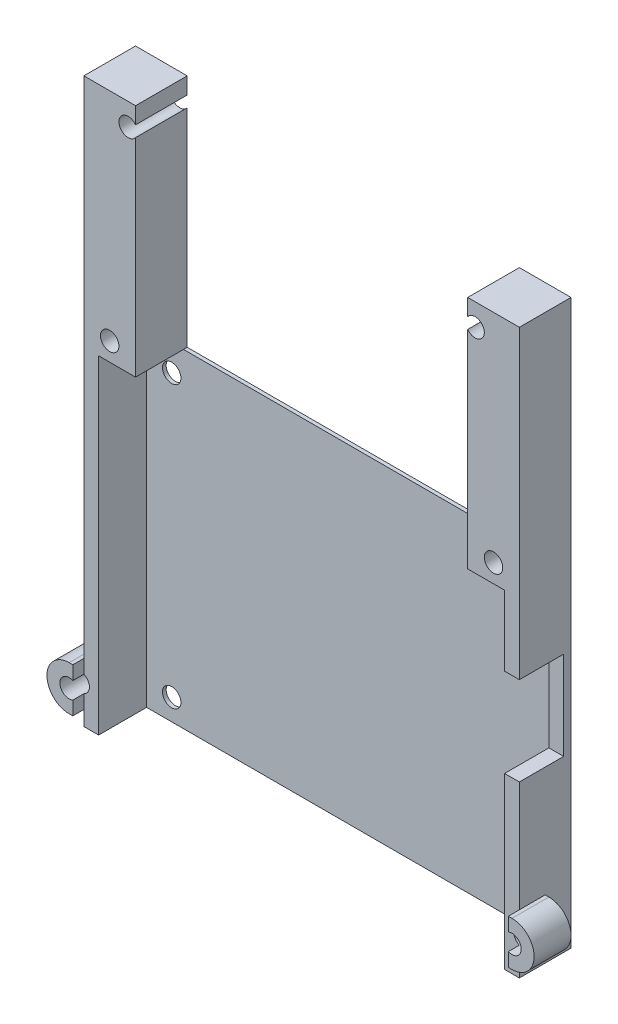
from build123d import *
from build123d.topology import SkipClean

# Parameters (mm, degrees)
BOSS_EXTRUDE1_DEPTH = 44.5
SKETCH2_W           = 6
SKETCH2_H           = 12
CUT_EXTRUDE1_DEPTH  = 10
BOSS_EXTRUDE2_DEPTH = 8.5
CUT_EXTRUDE2_DEPTH  = 11
SKETCH4_W           = 7
SKETCH4_H           = 7
BOSS_EXTRUDE3_DEPTH = 5
SKETCH9_W           = 7
SKETCH9_H           = 7
BOSS_EXTRUDE5_DEPTH = 26.85
SKETCH5_R           = 1.25
CUT_EXTRUDE3_DEPTH  = 100.034451076
SKETCH7_R           = 1.25
CUT_EXTRUDE4_DEPTH  = 10
CUT_EXTRUDE6_DEPTH  = 3.5
BOSS_EXTRUDE4_DEPTH = 3


with BuildPart() as part:
    # Sketch1 → Boss-Extrude1 (new body)
    with BuildSketch(Plane(origin=(0, 0, 0), x_dir=(1, 0, 0), z_dir=(0, 1, 0))):
        Polygon((0, 0), (2, 0), (2, 6.5), (57, 6.5), (57, 0), (59, 0), (59, 7), (0, 7), align=None)
    extrude(amount=BOSS_EXTRUDE1_DEPTH)

    # Sketch2 → Cut-Extrude1 (cut)
    with BuildSketch(Plane(origin=(59, 0, 0), x_dir=(0, 0, -1), z_dir=(1, 0, 0))):
        with Locations((3, 29)):
            Rectangle(SKETCH2_W, SKETCH2_H)
    extrude(amount=-CUT_EXTRUDE1_DEPTH, mode=Mode.SUBTRACT)

    # Sketch3 → Boss-Extrude2 (add)
    with BuildSketch(Plane(origin=(0, 0, -7), x_dir=(-1, 0, 0), z_dir=(0, 0, -1))):
        with BuildLine():
            Line((-59, 6.145643924), (-59, 8))
            Line((-59, 8), (-59.5, 8))
            ThreePointArc((-59.5, 8), (-62.5, 5), (-59.5, 2))
            Line((-59.5, 2), (-59, 2))
            Line((-59, 2), (-59, 3.854356076))
            ThreePointArc((-59, 3.854356076), (-60.75, 5), (-59, 6.145643924))
        make_face()
        with BuildLine():
            Line((0.5, 8), (0, 8))
            Line((0, 8), (0, 6.145643924))
            ThreePointArc((0, 6.145643924), (1.75, 5), (0, 3.854356076))
            Line((0, 3.854356076), (0, 2))
            Line((0, 2), (0.5, 2))
            ThreePointArc((0.5, 2), (3.5, 5), (0.5, 8))
        make_face()
    extrude(amount=-BOSS_EXTRUDE2_DEPTH)

    # Sketch3<3> → Cut-Extrude2 (cut)
    with SkipClean():  # the faces are left unmerged after this step: merging them gives an invalid solid
        with BuildSketch(Plane(origin=(0, 0, -7), x_dir=(-1, 0, 0), z_dir=(0, 0, -1))):
            with BuildLine():
                ThreePointArc((-59, 3.854356076), (-58.25, 5), (-59, 6.145643924))
                Line((-59, 6.145643924), (-59, 3.854356076))
            make_face()
            with BuildLine():
                Line((0, 3.854356076), (0, 6.145643924))
                ThreePointArc((0, 6.145643924), (-0.75, 5), (0, 3.854356076))
            make_face()
        extrude(amount=-CUT_EXTRUDE2_DEPTH, mode=Mode.SUBTRACT)

    # Sketch4 → Boss-Extrude3 (add)
    with SkipClean():  # the faces are left unmerged after this step: merging them gives an invalid solid
        with BuildSketch(Plane(origin=(0, 44.5, 0), x_dir=(1, 0, 0), z_dir=(0, 1, 0))):
            with Locations((3.5, 3.5)):
                Rectangle(SKETCH4_W, SKETCH4_H)
            with Locations((55.5, 3.5)):
                Rectangle(SKETCH4_W, SKETCH4_H)
        extrude(amount=BOSS_EXTRUDE3_DEPTH)

    # Sketch9 → Boss-Extrude5 (add)
    with SkipClean():  # the faces are left unmerged after this step: merging them gives an invalid solid
        with BuildSketch(Plane(origin=(0, 49.5, 0), x_dir=(1, 0, 0), z_dir=(0, 1, 0))):
            with Locations((3.5, 3.5)):
                Rectangle(SKETCH9_W, SKETCH9_H)
            with Locations((55.5, 3.5)):
                Rectangle(SKETCH9_W, SKETCH9_H)
        extrude(amount=BOSS_EXTRUDE5_DEPTH)

    # Sketch5 → Cut-Extrude3 (cut, through all)
    with SkipClean():  # the faces are left unmerged after this step: merging them gives an invalid solid
        with BuildSketch(Plane(origin=(0, 0, -7), x_dir=(-1, 0, 0), z_dir=(0, 0, -1))):
            with Locations((-55.5, 47)):
                Circle(SKETCH5_R)
            with Locations((-3.5, 47)):
                Circle(SKETCH5_R)
            with Locations((-6, 73.35)):
                Circle(SKETCH5_R)
            with Locations((-53, 73.35)):
                Circle(SKETCH5_R)
        extrude(amount=-CUT_EXTRUDE3_DEPTH, mode=Mode.SUBTRACT)

    # Sketch7 → Cut-Extrude4 (cut)
    with SkipClean():  # the faces are left unmerged after this step: merging them gives an invalid solid
        with BuildSketch(Plane(origin=(0, 0, -7), x_dir=(-1, 0, 0), z_dir=(0, 0, -1))):
            with Locations((-5.4, 2.9)):
                Circle(SKETCH7_R)
            with Locations((-53.6, 2.9)):
                Circle(SKETCH7_R)
            with Locations((-53.6, 40.95)):
                Circle(SKETCH7_R)
            with Locations((-5.4, 40.95)):
                Circle(SKETCH7_R)
        extrude(amount=-CUT_EXTRUDE4_DEPTH, mode=Mode.SUBTRACT)

    # Sketch3<4> → Cut-Extrude6 (cut)
    with SkipClean():  # the faces are left unmerged after this step: merging them gives an invalid solid
        with BuildSketch(Plane(origin=(0, 0, -7), x_dir=(-1, 0, 0), z_dir=(0, 0, -1))):
            with BuildLine():
                Line((-59, 6.145643924), (-59, 8))
                Line((-59, 8), (-59.5, 8))
                ThreePointArc((-59.5, 8), (-62.5, 5), (-59.5, 2))
                Line((-59.5, 2), (-59, 2))
                Line((-59, 2), (-59, 3.854356076))
                ThreePointArc((-59, 3.854356076), (-60.75, 5), (-59, 6.145643924))
            make_face()
            with BuildLine():
                Line((0.5, 8), (0, 8))
                Line((0, 8), (0, 6.145643924))
                ThreePointArc((0, 6.145643924), (1.75, 5), (0, 3.854356076))
                Line((0, 3.854356076), (0, 2))
                Line((0, 2), (0.5, 2))
                ThreePointArc((0.5, 2), (3.5, 5), (0.5, 8))
            make_face()
        extrude(amount=-CUT_EXTRUDE6_DEPTH, mode=Mode.SUBTRACT)

    # Sketch3<5> → Boss-Extrude4 (add)
    with SkipClean():  # the faces are left unmerged after this step: merging them gives an invalid solid
        with BuildSketch(Plane(origin=(0, 0, -7), x_dir=(-1, 0, 0), z_dir=(0, 0, -1))):
            with BuildLine():
                ThreePointArc((-59, 3.854356076), (-58.25, 5), (-59, 6.145643924))
                Line((-59, 6.145643924), (-59, 3.854356076))
            make_face()
            with BuildLine():
                Line((0, 3.854356076), (0, 6.145643924))
                ThreePointArc((0, 6.145643924), (-0.75, 5), (0, 3.854356076))
            make_face()
        extrude(amount=-BOSS_EXTRUDE4_DEPTH)


solid = part.part
